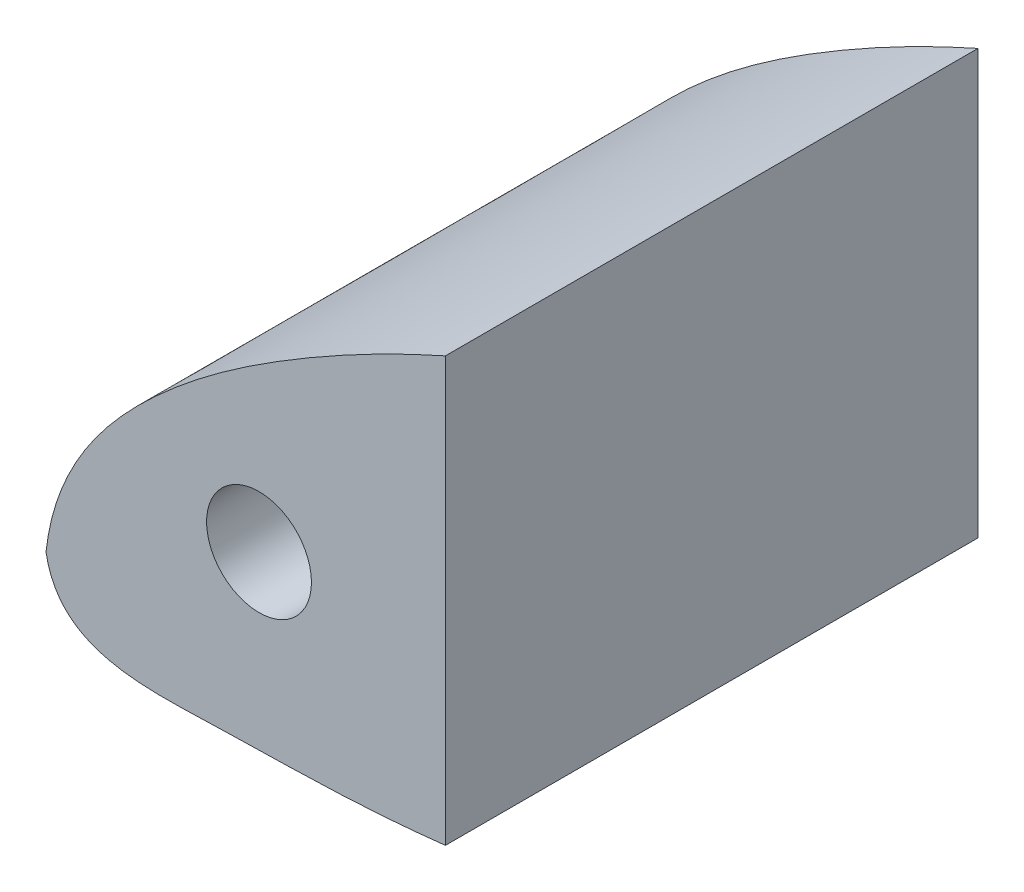
from build123d import *

# Parameters (mm, degrees)
BOSS_EXTRUDE1_DEPTH = 50.8
SKETCH2_R           = 5
SKETCH2_R_2         = 3.175
CUT_EXTRUDE1_DEPTH  = 320.788688435
SKETCH3_W           = 293.188888759
SKETCH3_H           = 137.971241769
CUT_EXTRUDE2_DEPTH  = 320.788688435


with BuildPart() as part:
    # Sketch1 → Boss-Extrude1 (new body)
    with BuildSketch(Plane.XY):
        with BuildLine():
            add(Edge.make_bspline(
                [(0.000560351, 0.000130087), (0.810633127, 7.359196055), (8.649092025, 17.856605174), (26.286719818, 29.975176328), (52.111128271, 42.069215275), (89.597618475, 49.290763054), (131.400792109, 47.884831915), (173.256699242, 40.041104278), (217.961060472, 29.612974894), (256.952064401, 19.528920948), (290.35983767, 8.71099439), (301.273197721, 4.382828139), (314.816918223, -0.516206742), (309.846313895, 0.000130087)],
                knots=[0, 0, 0, 0, 0.060863618, 0.113688265, 0.188608742, 0.312908923, 0.448482434, 0.557612135, 0.691544113, 0.852438279, 0.92975597, 0.976058229, 1, 1, 1, 1], degree=3))
            add(Edge.make_bspline(
                [(309.846313895, 0.000130087), (303.956832565, 1.47095521), (293.989507544, 2.093987313), (276.26402299, 4.514356704), (260.846344817, 5.427413394), (235.858814759, 7.870306192), (205.101424636, 8.838080282), (157.718638092, 9.030650149), (110.497331172, 6.181495223), (66.506197185, -0.586669107), (36.454672816, -6.098499901), (15.316603331, -6.189065841), (1.230714189, -6.924076091), (0.000560351, 0.000130087)],
                knots=[0, 0, 0, 0, 0.057787081, 0.095274891, 0.171021118, 0.205339302, 0.335319146, 0.464904334, 0.658702312, 0.785511947, 0.893517288, 0.94309214, 1, 1, 1, 1], degree=3))
        make_face()
    extrude(amount=BOSS_EXTRUDE1_DEPTH)

    # Sketch2 → Cut-Extrude1 (cut, through all)
    with BuildSketch(Plane.XY.offset(50.8)):
        with Locations((20.32, 10.16)):
            Circle(SKETCH2_R)
        with Locations((227.296313895, 19.050130087)):
            Circle(SKETCH2_R_2)
    extrude(amount=-CUT_EXTRUDE1_DEPTH, mode=Mode.SUBTRACT)

    # Sketch3 → Cut-Extrude2 (cut, through all)
    with BuildSketch(Plane.XY.offset(50.8)):
        with Locations((184.69444438, 2.732377951)):
            Rectangle(SKETCH3_W, SKETCH3_H)
    extrude(amount=-CUT_EXTRUDE2_DEPTH, mode=Mode.SUBTRACT)


solid = part.part
